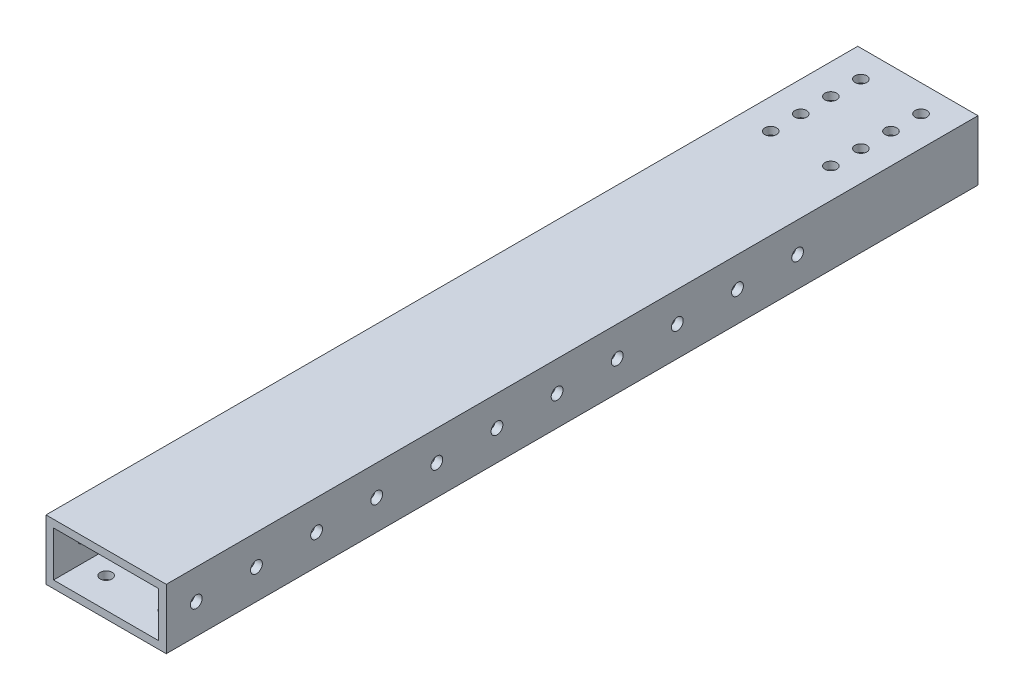
from build123d import *

# Parameters (mm, degrees)
SKETCH1_W           = 50.8
SKETCH1_H           = 342.9
BOSS_EXTRUDE1_DEPTH = 25.4
SHELL1_T            = -3.175
SKETCH2_R           = 2.4892
CUT_EXTRUDE1_DEPTH  = 348.571877458
SKETCH3_R           = 2.4892
CUT_EXTRUDE2_DEPTH  = 348.571877458
CUT_EXTRUDE3_REACH  = 349.572
SKETCH4_R           = 2.4892


with BuildPart() as part:
    # Sketch1 → Boss-Extrude1 (new body)
    with BuildSketch(Plane(origin=(0, 0, 0), x_dir=(1, 0, 0), z_dir=(0, 1, 0))):
        with Locations((25.4, 171.45)):
            Rectangle(SKETCH1_W, SKETCH1_H)
    extrude(amount=BOSS_EXTRUDE1_DEPTH)

    # Shell1
    shell1_openings = [part.faces().sort_by_distance(p)[0] for p in [
        (25.4, 12.7, -342.9),
        (25.4, 12.7, 0),
    ]]
    offset(amount=SHELL1_T, openings=shell1_openings, kind=Kind.INTERSECTION)

    # Sketch2 → Cut-Extrude1 (cut, through all)
    with BuildSketch(Plane.ZY):
        with Locations((-12.7, 12.7)):
            Circle(SKETCH2_R)
        with Locations((-38.1, 12.7)):
            Circle(SKETCH2_R)
        with Locations((-63.5, 12.7)):
            Circle(SKETCH2_R)
        with Locations((-88.9, 12.7)):
            Circle(SKETCH2_R)
        with Locations((-114.3, 12.7)):
            Circle(SKETCH2_R)
        with Locations((-139.7, 12.7)):
            Circle(SKETCH2_R)
        with Locations((-165.1, 12.7)):
            Circle(SKETCH2_R)
        with Locations((-190.5, 12.7)):
            Circle(SKETCH2_R)
        with Locations((-215.9, 12.7)):
            Circle(SKETCH2_R)
        with Locations((-241.3, 12.7)):
            Circle(SKETCH2_R)
        with Locations((-266.7, 12.7)):
            Circle(SKETCH2_R)
    extrude(amount=-CUT_EXTRUDE1_DEPTH, mode=Mode.SUBTRACT)

    # Sketch3 → Cut-Extrude2 (cut, through all)
    with BuildSketch(Plane(origin=(0, 25.4, 0), x_dir=(1, 0, 0), z_dir=(0, 1, 0))):
        with Locations((12.7, 293.424634479)):
            Circle(SKETCH3_R)
        with Locations((38.1, 293.424634479)):
            Circle(SKETCH3_R)
        with Locations((38.1, 306.124634479)):
            Circle(SKETCH3_R)
        with Locations((12.7, 306.124634479)):
            Circle(SKETCH3_R)
        with Locations((12.7, 318.824634479)):
            Circle(SKETCH3_R)
        with Locations((38.1, 318.824634479)):
            Circle(SKETCH3_R)
        with Locations((38.1, 331.524634479)):
            Circle(SKETCH3_R)
        with Locations((12.7, 331.524634479)):
            Circle(SKETCH3_R)
    extrude(amount=-CUT_EXTRUDE2_DEPTH, mode=Mode.SUBTRACT)

    # Sketch4 → Cut-Extrude3 (cut, up to next)
    with BuildSketch(Plane.XZ, mode=Mode.PRIVATE) as cut_extrude3_sk1:
        with Locations((38.1, -12.7)):
            Circle(SKETCH4_R)
    cut_extrude3_tool1 = extrude(cut_extrude3_sk1.sketch, amount=-CUT_EXTRUDE3_REACH, mode=Mode.PRIVATE) & part.part
    # Sketch4 → Cut-Extrude3 (cut, up to next)
    with BuildSketch(Plane.XZ, mode=Mode.PRIVATE) as cut_extrude3_sk2:
        with Locations((12.7, -12.7)):
            Circle(SKETCH4_R)
    cut_extrude3_tool2 = extrude(cut_extrude3_sk2.sketch, amount=-CUT_EXTRUDE3_REACH, mode=Mode.PRIVATE) & part.part
    # Sketch4 → Cut-Extrude3 (cut, up to next)
    with BuildSketch(Plane.XZ, mode=Mode.PRIVATE) as cut_extrude3_sk3:
        with Locations((12.7, -25.4)):
            Circle(SKETCH4_R)
    cut_extrude3_tool3 = extrude(cut_extrude3_sk3.sketch, amount=-CUT_EXTRUDE3_REACH, mode=Mode.PRIVATE) & part.part
    # Sketch4 → Cut-Extrude3 (cut, up to next)
    with BuildSketch(Plane.XZ, mode=Mode.PRIVATE) as cut_extrude3_sk4:
        with Locations((38.1, -25.4)):
            Circle(SKETCH4_R)
    cut_extrude3_tool4 = extrude(cut_extrude3_sk4.sketch, amount=-CUT_EXTRUDE3_REACH, mode=Mode.PRIVATE) & part.part
    # Sketch4 → Cut-Extrude3 (cut, up to next)
    with BuildSketch(Plane.XZ, mode=Mode.PRIVATE) as cut_extrude3_sk5:
        with Locations((38.1, -38.1)):
            Circle(SKETCH4_R)
    cut_extrude3_tool5 = extrude(cut_extrude3_sk5.sketch, amount=-CUT_EXTRUDE3_REACH, mode=Mode.PRIVATE) & part.part
    # Sketch4 → Cut-Extrude3 (cut, up to next)
    with BuildSketch(Plane.XZ, mode=Mode.PRIVATE) as cut_extrude3_sk6:
        with Locations((12.7, -38.1)):
            Circle(SKETCH4_R)
    cut_extrude3_tool6 = extrude(cut_extrude3_sk6.sketch, amount=-CUT_EXTRUDE3_REACH, mode=Mode.PRIVATE) & part.part
    # Sketch4 → Cut-Extrude3 (cut, up to next)
    with BuildSketch(Plane.XZ, mode=Mode.PRIVATE) as cut_extrude3_sk7:
        with Locations((12.7, -50.8)):
            Circle(SKETCH4_R)
    cut_extrude3_tool7 = extrude(cut_extrude3_sk7.sketch, amount=-CUT_EXTRUDE3_REACH, mode=Mode.PRIVATE) & part.part
    # Sketch4 → Cut-Extrude3 (cut, up to next)
    with BuildSketch(Plane.XZ, mode=Mode.PRIVATE) as cut_extrude3_sk8:
        with Locations((38.1, -50.8)):
            Circle(SKETCH4_R)
    cut_extrude3_tool8 = extrude(cut_extrude3_sk8.sketch, amount=-CUT_EXTRUDE3_REACH, mode=Mode.PRIVATE) & part.part
    # Sketch4 → Cut-Extrude3 (cut, up to next)
    with BuildSketch(Plane.XZ, mode=Mode.PRIVATE) as cut_extrude3_sk9:
        with Locations((38.1, -63.5)):
            Circle(SKETCH4_R)
    cut_extrude3_tool9 = extrude(cut_extrude3_sk9.sketch, amount=-CUT_EXTRUDE3_REACH, mode=Mode.PRIVATE) & part.part
    # Sketch4 → Cut-Extrude3 (cut, up to next)
    with BuildSketch(Plane.XZ, mode=Mode.PRIVATE) as cut_extrude3_sk10:
        with Locations((12.7, -63.5)):
            Circle(SKETCH4_R)
    cut_extrude3_tool10 = extrude(cut_extrude3_sk10.sketch, amount=-CUT_EXTRUDE3_REACH, mode=Mode.PRIVATE) & part.part
    add(cut_extrude3_tool1.solids().sort_by_distance((38.1, 0, -12.7))[0], mode=Mode.SUBTRACT)
    add(cut_extrude3_tool2.solids().sort_by_distance((12.7, 0, -12.7))[0], mode=Mode.SUBTRACT)
    add(cut_extrude3_tool3.solids().sort_by_distance((12.7, 0, -25.4))[0], mode=Mode.SUBTRACT)
    add(cut_extrude3_tool4.solids().sort_by_distance((38.1, 0, -25.4))[0], mode=Mode.SUBTRACT)
    add(cut_extrude3_tool5.solids().sort_by_distance((38.1, 0, -38.1))[0], mode=Mode.SUBTRACT)
    add(cut_extrude3_tool6.solids().sort_by_distance((12.7, 0, -38.1))[0], mode=Mode.SUBTRACT)
    add(cut_extrude3_tool7.solids().sort_by_distance((12.7, 0, -50.8))[0], mode=Mode.SUBTRACT)
    add(cut_extrude3_tool8.solids().sort_by_distance((38.1, 0, -50.8))[0], mode=Mode.SUBTRACT)
    add(cut_extrude3_tool9.solids().sort_by_distance((38.1, 0, -63.5))[0], mode=Mode.SUBTRACT)
    add(cut_extrude3_tool10.solids().sort_by_distance((12.7, 0, -63.5))[0], mode=Mode.SUBTRACT)


solid = part.part
